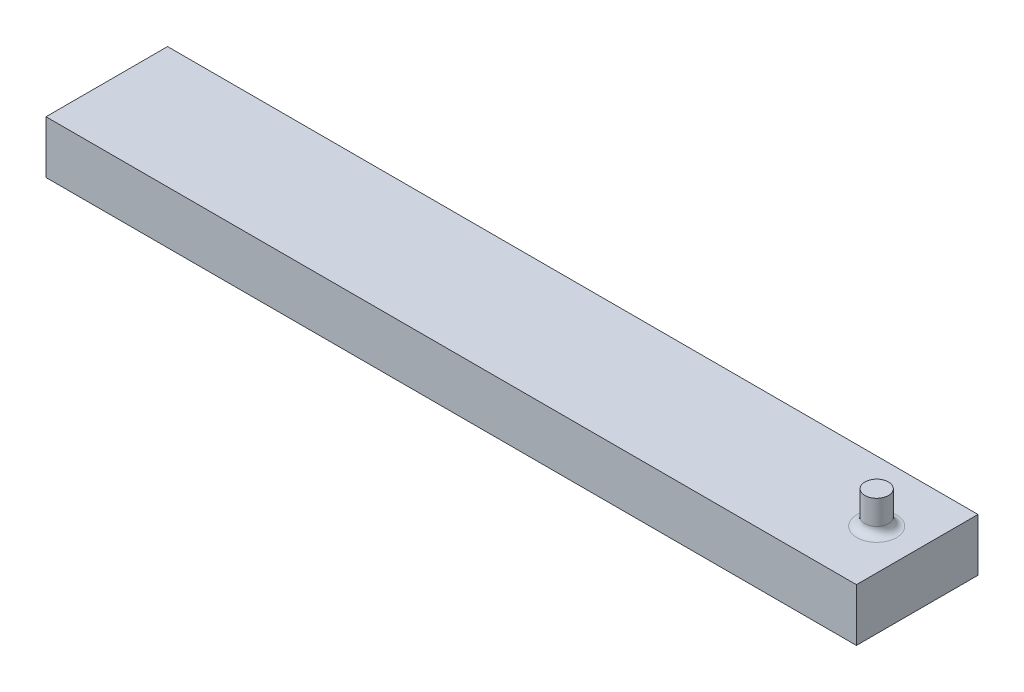
from build123d import *

# Parameters (mm, degrees)
SKETCH2_W           = 100
SKETCH2_H           = 15
BOSS_EXTRUDE1_DEPTH = 3.25
SKETCH4_R           = 1.45
BOSS_EXTRUDE2_DEPTH = 4
SKETCH5_R           = 5.1
CUT_EXTRUDE1_DEPTH  = 4
FILLET1_R           = 1
CUT_EXTRUDE3_DEPTH  = 1.125


with BuildPart() as part:
    # Sketch2 → Boss-Extrude1 (new, symmetric)
    with BuildSketch(Plane(origin=(0, 0, 0), x_dir=(1, 0, 0), z_dir=(0, 1, 0))):
        Rectangle(SKETCH2_W, SKETCH2_H)
    extrude(amount=BOSS_EXTRUDE1_DEPTH, both=True)

    # Sketch4 → Boss-Extrude2 (add)
    with BuildSketch(Plane(origin=(0, 3.25, 0), x_dir=(1, 0, 0), z_dir=(0, 1, 0))):
        with Locations((45, 0)):
            Circle(SKETCH4_R)
    extrude(amount=BOSS_EXTRUDE2_DEPTH)

    # Sketch5 → Cut-Extrude1 (cut)
    with BuildSketch(Plane(origin=(0, -3.25, 0), x_dir=(-1, 0, 0), z_dir=(0, -1, 0))):
        with Locations((38.1, 0)):
            Circle(SKETCH5_R)
    extrude(amount=-CUT_EXTRUDE1_DEPTH, mode=Mode.SUBTRACT)

    # Fillet1
    fillet1_edges = [part.edges().sort_by_distance(p)[0] for p in [
        (43.55, 3.25, 0),
    ]]
    fillet(fillet1_edges, radius=FILLET1_R)

    # Sketch6 → Cut-Extrude3 (cut, symmetric)
    with BuildSketch(Plane.XY):
        Polygon((-23.5, 0.75), (-23.5, -3.25), (-15, -3.25), (-15, -2.5), (-10, -2.5), (-10, 0.75), align=None)
    extrude(amount=CUT_EXTRUDE3_DEPTH, both=True, mode=Mode.SUBTRACT)


solid = part.part
